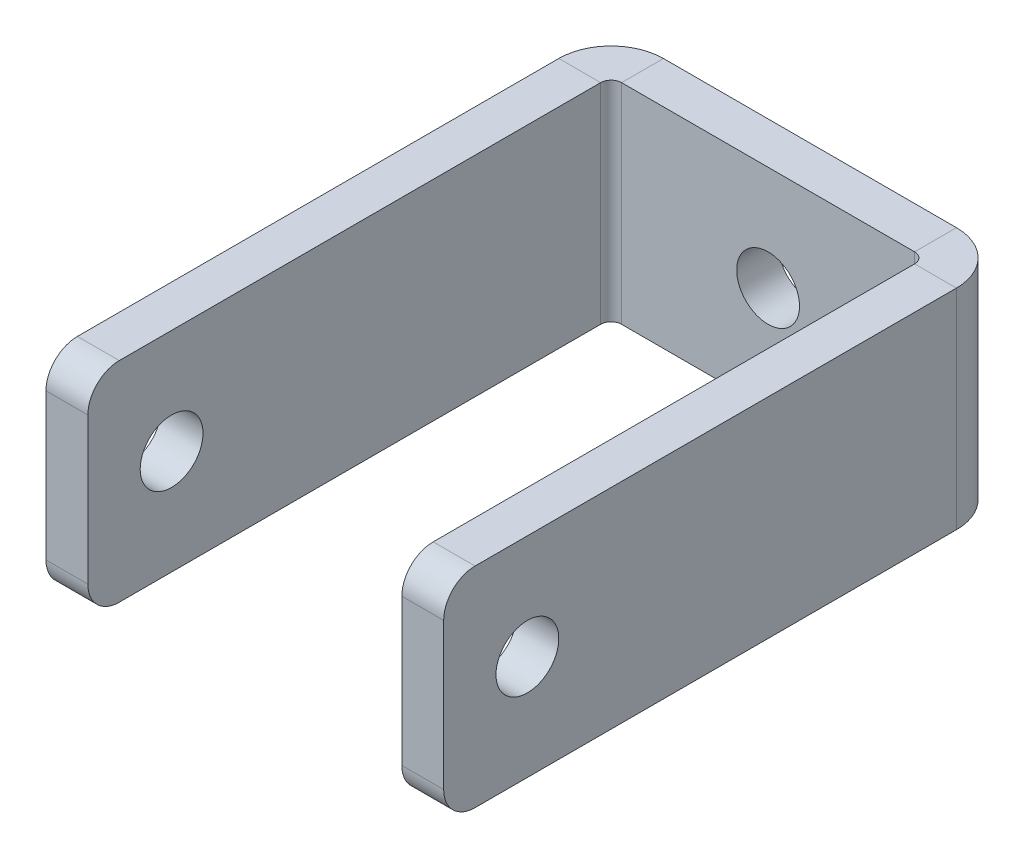
from build123d import *

# Parameters (mm, degrees)
SKETCH_1_W                         = 30
SKETCH_1_H                         = 20
SM_BASE_FLANGE_1_DEPTH             = 4
SM_EDGE_FLANGE_1_STRIP_W           = 18
SM_EDGE_FLANGE_1_STRIP_H           = 4
SM_EDGE_FLANGE_1_STRIP_CUT_DEPTH   = 20
SM_EDGE_FLANGE_1_STRIP_2_W         = 18
SM_EDGE_FLANGE_1_STRIP_2_H         = 4
SM_EDGE_FLANGE_1_STRIP_CUT_2_DEPTH = 20
SM_EDGE_FLANGE_1_DEPTH             = 20
SM_EDGE_FLANGE_1_BEND_DEPTH        = 20
FILLET_1_R                         = 3
SKETCH_12_R                        = 3
CUT_EXTRUDE_1_DEPTH                = 10
SKETCH_13_R                        = 3
CUT_EXTRUDE_2_DEPTH                = 64.592452382


# Sheet-metal steps are written as plain solids
with BuildPart() as part:
    # Sketch 1 → 基体-法兰1 (new body)
    with BuildSketch(Plane.XY):
        Rectangle(SKETCH_1_W, SKETCH_1_H)
    extrude(amount=-SM_BASE_FLANGE_1_DEPTH)

    # 边线-法兰1 strip (across the edge) → 边线-法兰1 strip cut (cut)
    with BuildSketch(Plane(origin=(-15, 10, 0), x_dir=(1, 0, 0), z_dir=(0, -1, 0))):
        with Locations((-8, -2)):
            Rectangle(SM_EDGE_FLANGE_1_STRIP_W, SM_EDGE_FLANGE_1_STRIP_H)
    extrude(amount=SM_EDGE_FLANGE_1_STRIP_CUT_DEPTH, mode=Mode.SUBTRACT)

    # 边线-法兰1 strip 2 (across the edge) → 边线-法兰1 strip cut 2 (cut)
    with BuildSketch(Plane(origin=(15, -10, 0), x_dir=(-1, 0, 0), z_dir=(0, 1, 0))):
        with Locations((-8, -2)):
            Rectangle(SM_EDGE_FLANGE_1_STRIP_2_W, SM_EDGE_FLANGE_1_STRIP_2_H)
    extrude(amount=SM_EDGE_FLANGE_1_STRIP_CUT_2_DEPTH, mode=Mode.SUBTRACT)

    # 边线-法兰1 section (across the edge) → 边线-法兰1 (add)
    with BuildSketch(Plane(origin=(-15, 10, 0), x_dir=(1, 0, 0), z_dir=(0, -1, 0))):
        with BuildLine():
            Line((-4, 1), (-4, 50))
            Line((-4, 50), (0, 50))
            Line((0, 50), (0, 1))
            ThreePointArc((0, 1), (0.292893219, 0.292893219), (1, 0))
            Line((1, 0), (1, -4))
            ThreePointArc((1, -4), (-2.535533906, -2.535533906), (-4, 1))
        make_face()
    extrude(amount=SM_EDGE_FLANGE_1_DEPTH)

    # 边线-法兰1 section 2 (across the edge) → 边线-法兰1 bend (add)
    with BuildSketch(Plane(origin=(15, -10, 0), x_dir=(-1, 0, 0), z_dir=(0, 1, 0))):
        with BuildLine():
            Line((-4, 1), (-4, 50))
            Line((-4, 50), (0, 50))
            Line((0, 50), (0, 1))
            ThreePointArc((0, 1), (0.292893219, 0.292893219), (1, 0))
            Line((1, 0), (1, -4))
            ThreePointArc((1, -4), (-2.535533906, -2.535533906), (-4, 1))
        make_face()
    extrude(amount=SM_EDGE_FLANGE_1_BEND_DEPTH)

    # 圆角1
    fillet_1_edges = [part.edges().sort_by_distance(p)[0] for p in [
        (-17, 10, 50),
        (-17, -10, 50),
        (17, -10, 50),
        (17, 10, 50),
    ]]
    fillet(fillet_1_edges, radius=FILLET_1_R)

    # 草图12 → 切除-拉伸1 (cut)
    with BuildSketch(Plane.XY):
        Circle(SKETCH_12_R)
    extrude(amount=-CUT_EXTRUDE_1_DEPTH, mode=Mode.SUBTRACT)

    # 草图13 → 切除-拉伸2 (cut, through all)
    with BuildSketch(Plane.ZY.offset(19)):
        with Locations((42, 0)):
            Circle(SKETCH_13_R)
    extrude(amount=-CUT_EXTRUDE_2_DEPTH, mode=Mode.SUBTRACT)


solid = part.part
